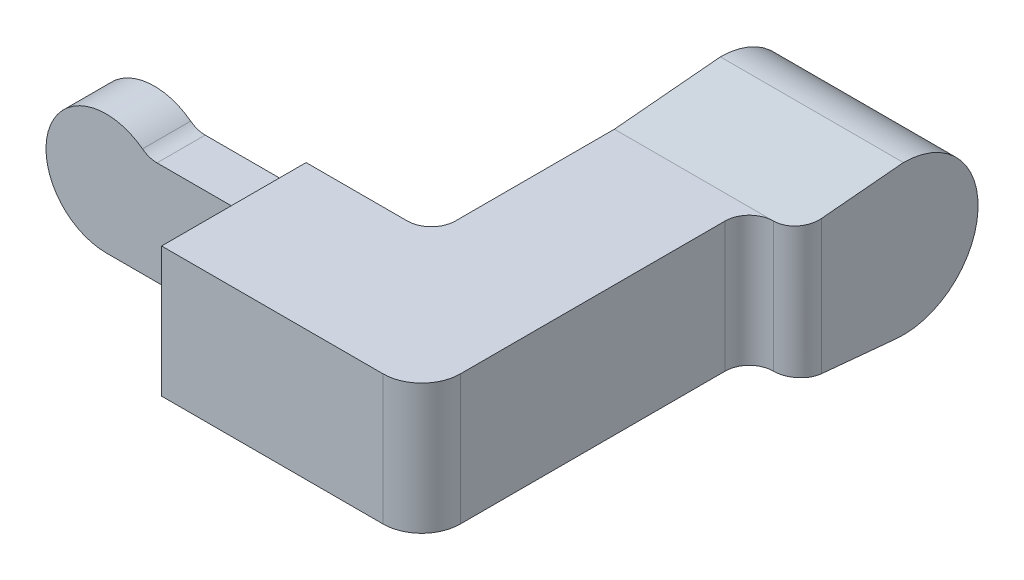
from build123d import *

# Parameters (mm, degrees)
BOSS_EXTRUDE1_DEPTH      = 13.5
BOSS_EXTRUDE1_DEPTH_BACK = 13.5
BOSS_EXTRUDE2_START      = -30
BOSS_EXTRUDE2_DEPTH      = 10
FILLET3_R                = 2
BOSS_EXTRUDE3_DEPTH      = 38
FILLET4_R                = 5
FILLET5_R                = 5


with BuildPart() as part:
    # Sketch1 → Boss-Extrude1 (new, two sides: drawn at the far end of the back side and taken through both)
    with BuildSketch(Plane(origin=(0, 0, 0), x_dir=(1, 0, 0), z_dir=(0, 1, 0)).offset(-BOSS_EXTRUDE1_DEPTH_BACK)):
        with BuildLine():
            Line((0, 0), (46, 0))
            ThreePointArc((46, 0), (51.656854249, 2.343145751), (54, 8))
            Line((54, 8), (54, 68))
            Line((54, 68), (26, 68))
            Line((26, 68), (26, 35))
            ThreePointArc((26, 35), (24.535533906, 31.464466094), (21, 30))
            Line((21, 30), (0, 30))
            Line((0, 30), (0, 15))
            Line((0, 15), (0, 0))
        make_face()
    extrude(amount=BOSS_EXTRUDE1_DEPTH + BOSS_EXTRUDE1_DEPTH_BACK)

    # Sketch2 → Boss-Extrude2 (add)
    with BuildSketch(Plane.XY.offset(BOSS_EXTRUDE2_START)):
        with BuildLine():
            Line((0, -13.5), (-31.5, -13.5))
            ThreePointArc((-31.5, -13.5), (-43.351405537, 2.974190082), (-23.964041865, 8.972930111))
            ThreePointArc((-23.964041865, 8.972930111), (-22.539334644, 8.22153994), (-20.949658611, 7.962102155))
            Line((-20.949658611, 7.962102155), (0, 7.962102155))
            Line((0, 7.962102155), (0, -13.5))
        make_face()
    extrude(amount=BOSS_EXTRUDE2_DEPTH)

    # Fillet3
    fillet3_edges = [part.edges().sort_by_distance(p)[0] for p in [
        (0, 7.962102155, -25),
        (0, -2.768948923, -20),
    ]]
    fillet(fillet3_edges, radius=FILLET3_R)

    # Sketch4 → Boss-Extrude3 (add)
    with BuildSketch(Plane.ZY.offset(-26)):
        with BuildLine():
            ThreePointArc((-90, 15.5), (-105.482977781, -0.726222431), (-88.549150224, -15.431948514))
            Line((-88.549150224, -15.431948514), (-68, -13.5))
            Line((-68, -13.5), (-68, 13.5))
            Line((-68, 13.5), (-87.204918033, 15.245901639))
            Line((-87.204918033, 15.245901639), (-90, 15.5))
        make_face()
    extrude(amount=-BOSS_EXTRUDE3_DEPTH)

    # Fillet4
    fillet4_edges = [part.edges().sort_by_distance(p)[0] for p in [
        (54, 0, -68),
    ]]
    fillet(fillet4_edges, radius=FILLET4_R)

    # Fillet5
    fillet5_edges = [part.edges().sort_by_distance(p)[0] for p in [
        (64, 0, -68),
    ]]
    fillet(fillet5_edges, radius=FILLET5_R - 0.0001)  # a hair under: the kernel refuses the full size


solid = part.part
